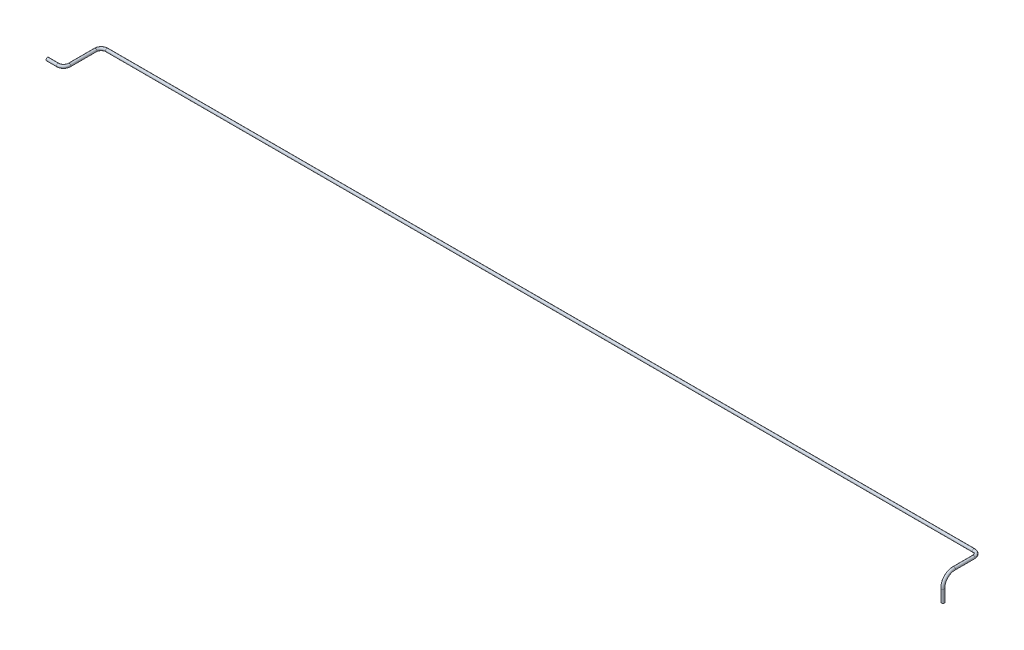
from build123d import *

# Parameters (mm, degrees)
SKETCH5_R   = 3.175
SKETCH5_R_2 = 2.667


with BuildPart() as part:
    # Sweep3: sweep along a curve in space
    with BuildLine() as sweep3_path:
        Line((0, 0, 0), (22.86, 0, 0))
        ThreePointArc((22.86, 0, 0), (31.840256121, 0, -3.719743879), (35.56, 0, -12.7))
        Line((35.56, 0, -12.7), (35.56, 0, -69.85))
        ThreePointArc((35.56, 0, -69.85), (39.279743879, 0, -78.830256121), (48.26, 0, -82.55))
        Line((48.26, 0, -82.55), (1952.967433402, 0, -82.55))
        ThreePointArc((1965.667433402, 0, -69.85), (1961.947689523, 0, -78.830256121), (1952.967433402, 0, -82.55))
        Line((1965.667433402, 0, -69.85), (1965.667433402, 0, -26.738510483))
        ThreePointArc((1965.667433402, 0, -26.738510483), (1965.922542224, -7.278969515, -8.93541517), (1966.541564008, -24.941395583, -1.342379026))
        Line((1966.541564008, -24.941395583, -1.342379026), (1967.446476937, -50.761097073, -0.891417753))
    # Sketch5 → Sweep3 (sweep)
    with BuildSketch(Plane(origin=(0, 0, 0), x_dir=(0, 0, -1), z_dir=(1, 0, 0))):
        Circle(SKETCH5_R)
        Circle(SKETCH5_R_2, mode=Mode.SUBTRACT)
    sweep(path=sweep3_path.line)


solid = part.part
